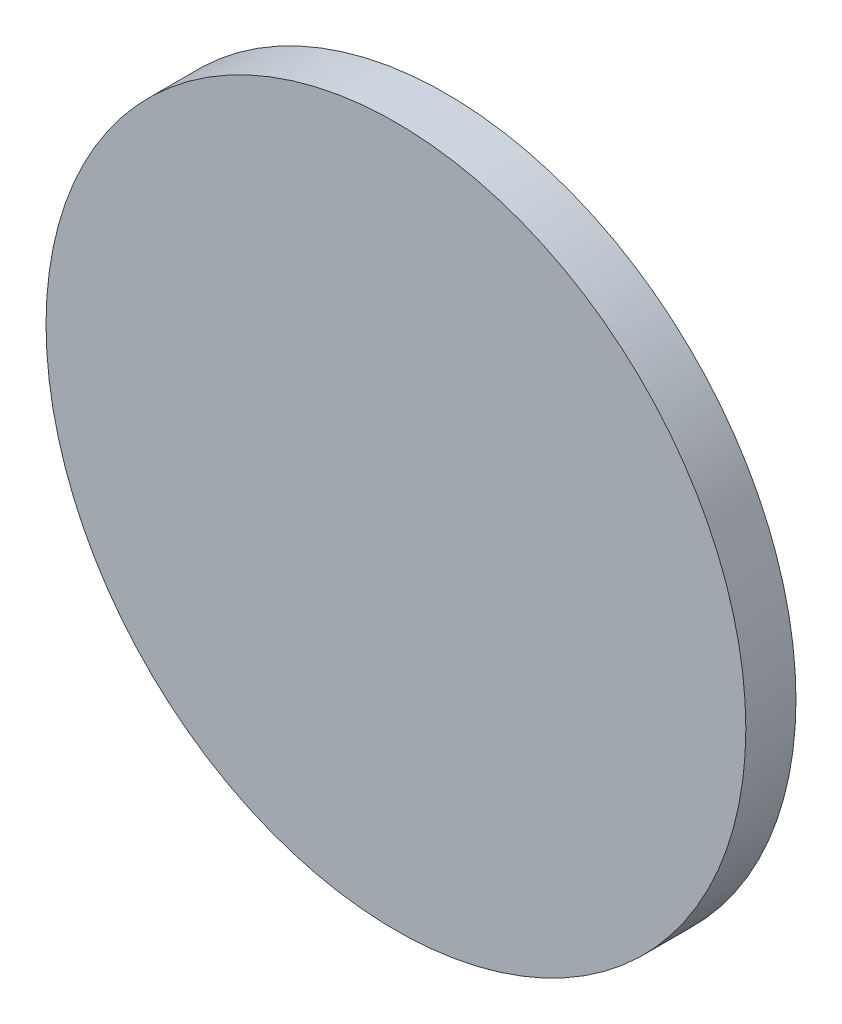
from build123d import *

# Parameters (mm, degrees)
ESQUISSE1_R        = 34.9
BOSS_EXTRU_1_DEPTH = 5


with BuildPart() as part:
    # Esquisse1 → Boss.-Extru.1 (new body)
    with BuildSketch(Plane.XY):
        Circle(ESQUISSE1_R)
    extrude(amount=BOSS_EXTRU_1_DEPTH)


solid = part.part
